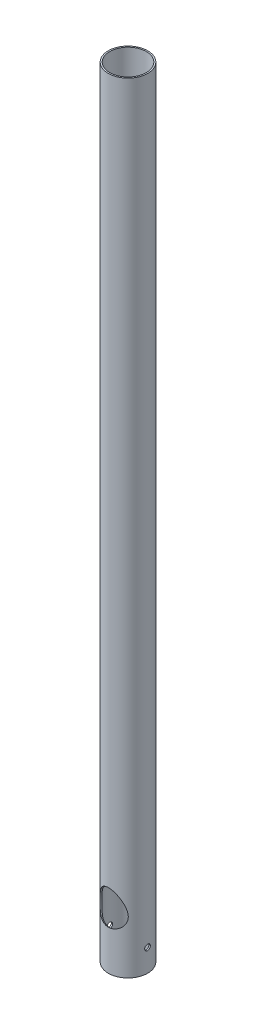
from build123d import *

# Parameters (mm, degrees)
EXTRUDE_1_OUTLINE_R      = 70
EXTRUDE_1_OUTLINE_R_2    = 65
EXTRUDE_1_DEPTH          = 2770
CUT_EXTRUDE_3_DEPTH      = 2772.768388592
CUT_EXTRUDE_3_DEPTH_BACK = 2772.768388592
SKETCH_6_R               = 10
SKETCH_7_R               = 50
CUT_EXTRUDE_4_DEPTH      = 200
SKETCH_13_R              = 52.5
CUT_EXTRUDE_8_DEPTH      = 200


# Read off the part's stored shape, not the designer's step: Вытянуть-Тонкостенный1
with BuildPart() as part:
    # Вытянуть-Тонкостенный1 outline → Вытянуть-Тонкостенный1 (new body)
    with BuildSketch(Plane(origin=(0, 0, 0), x_dir=(1, 0, 0), z_dir=(0, 1, 0))):
        Circle(EXTRUDE_1_OUTLINE_R)
        Circle(EXTRUDE_1_OUTLINE_R_2, mode=Mode.SUBTRACT)
    extrude(amount=EXTRUDE_1_DEPTH)

    # Эскиз6 → Вырез-Вытянуть3 (cut, two sides: drawn at the far end of the back side and taken through both)
    with BuildSketch(Plane(origin=(0, 0, 0), x_dir=(0, 0, -1), z_dir=(1, 0, 0)).offset(-CUT_EXTRUDE_3_DEPTH_BACK)):
        with Locations((0, 80)):
            Circle(SKETCH_6_R)
    extrude(amount=CUT_EXTRUDE_3_DEPTH + CUT_EXTRUDE_3_DEPTH_BACK, mode=Mode.SUBTRACT)

    # Эскиз7 → Вырез-Вытянуть4 (cut)
    with BuildSketch(Plane(origin=(0, 176.689515805, 252.338779809), x_dir=(1, 0, 0), z_dir=(0, -0.5735764363510416, -0.8191520442889949))):
        with Locations(Location((0, -126.118813858, 0), (0, 0, 90))):
            Circle(SKETCH_7_R)
    extrude(amount=CUT_EXTRUDE_4_DEPTH, mode=Mode.SUBTRACT)

    # Эскиз13 → Вырез-Вытянуть8 (cut)
    with BuildSketch(Plane(origin=(0, 750.265952156, 1071.490824098), x_dir=(1, 0, 0), z_dir=(0, -0.5735764363510416, -0.8191520442889949))):
        with Locations(Location((0, -2185, 0), (0, 0, 270))):
            Circle(SKETCH_13_R)
    extrude(amount=-CUT_EXTRUDE_8_DEPTH, mode=Mode.SUBTRACT)


solid = part.part
